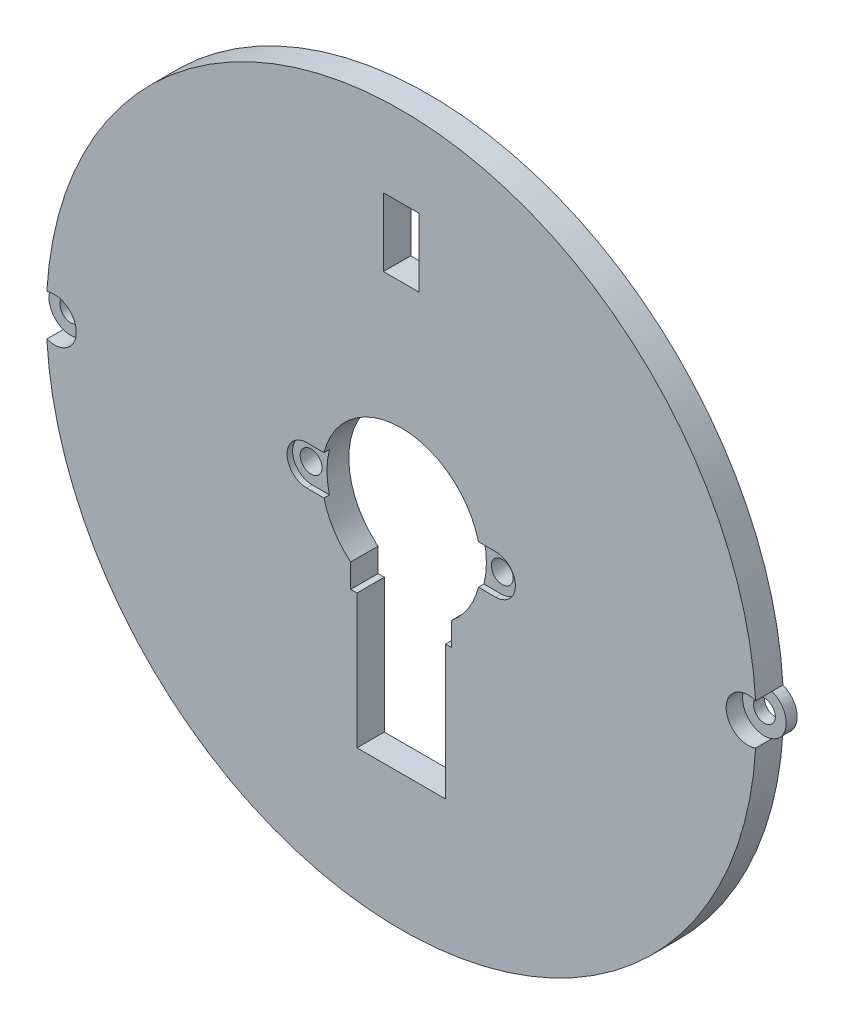
from build123d import *

# Parameters (mm, degrees)
SKETCH1_R           = 2
SKETCH1_W           = 6.5
SKETCH1_H           = 12.5
BOSS_EXTRUDE1_DEPTH = 5
SKETCH1_3_R         = 2
BOSS_EXTRUDE2_DEPTH = 4
SKETCH1_4_R         = 2
BOSS_EXTRUDE3_DEPTH = 1
SKETCH1_6_R         = 2
BOSS_EXTRUDE6_DEPTH = 5
SKETCH1_7_R         = 2
CUT_EXTRUDE1_DEPTH  = 3
SKETCH1_8_R         = 4
SKETCH1_8_R_2       = 2
BOSS_EXTRUDE7_DEPTH = 2


with BuildPart() as part:
    # Sketch1 → Boss-Extrude1 (new body)
    with BuildSketch(Plane.XY):
        with BuildLine():
            ThreePointArc((64.891732283, -3.750077499), (59.5, 0), (64.891732283, 3.750077499))
            ThreePointArc((64.891732283, 3.750077499), (0, 65), (-64.891732283, 3.750077499))
            ThreePointArc((-64.891732283, 3.750077499), (-61.216026394, 3.283818595), (-59.5, 0))
            ThreePointArc((-59.5, 0), (-61.216026394, -3.283818595), (-64.891732283, -3.750077499))
            ThreePointArc((-64.891732283, -3.750077499), (0, -65), (64.891732283, -3.750077499))
        make_face()
        with BuildLine():
            Line((-17.3, 3.6), (-14.149204925, 3.6))
            ThreePointArc((-14.149204925, 3.6), (0, 14.6), (14.149204925, 3.6))
            Line((14.149204925, 3.6), (17.3, 3.6))
            ThreePointArc((17.3, 3.6), (20.9, 0), (17.3, -3.6))
            Line((17.3, -3.6), (14.149204925, -3.6))
            ThreePointArc((14.149204925, -3.6), (12.316145556, -7.840443778), (9.25, -11.295906338))
            Line((9.25, -11.295906338), (9.25, -15.647016094))
            Line((9.25, -15.647016094), (8.1, -15.647016094))
            Line((8.1, -15.647016094), (8.1, -40.2))
            Line((8.1, -40.2), (-8.1, -40.2))
            Line((-8.1, -40.2), (-8.1, -15.647016094))
            Line((-8.1, -15.647016094), (-9.25, -15.647016094))
            Line((-9.25, -15.647016094), (-9.25, -11.295906338))
            ThreePointArc((-9.25, -11.295906338), (-12.316145556, -7.840443778), (-14.149204925, -3.6))
            Line((-14.149204925, -3.6), (-17.3, -3.6))
            ThreePointArc((-17.3, -3.6), (-20.9, 0), (-17.3, 3.6))
        make_face(mode=Mode.SUBTRACT)
        with Locations((0, 32)):
            Circle(SKETCH1_R, mode=Mode.SUBTRACT)
        with Locations((0, 44)):
            Rectangle(SKETCH1_W, SKETCH1_H, mode=Mode.SUBTRACT)
        with Locations((0, 56)):
            Circle(SKETCH1_R, mode=Mode.SUBTRACT)
    extrude(amount=BOSS_EXTRUDE1_DEPTH)

    # Sketch1<3> → Boss-Extrude2 (add)
    # profile 1 of 2: a face of its own
    with BuildSketch(Plane.XY):
        with BuildLine():
            ThreePointArc((-14.149204925, -3.6), (-14.6, 0), (-14.149204925, 3.6))
            Line((-14.149204925, 3.6), (-17.3, 3.6))
            ThreePointArc((-17.3, 3.6), (-20.9, 0), (-17.3, -3.6))
            Line((-17.3, -3.6), (-14.149204925, -3.6))
        make_face()
        with Locations((-17.5, 0)):
            Circle(SKETCH1_3_R, mode=Mode.SUBTRACT)
    # profile 2 of 2: a face of its own
    with BuildSketch(Plane.XY):
        with BuildLine():
            Line((17.3, 3.6), (14.149204925, 3.6))
            ThreePointArc((14.149204925, 3.6), (14.6, 0), (14.149204925, -3.6))
            Line((14.149204925, -3.6), (17.3, -3.6))
            ThreePointArc((17.3, -3.6), (20.9, 0), (17.3, 3.6))
        make_face()
        with Locations((17.5, 0)):
            Circle(SKETCH1_3_R, mode=Mode.SUBTRACT)
    extrude(amount=BOSS_EXTRUDE2_DEPTH)

    # Sketch1<4> → Boss-Extrude3 (add)
    with BuildSketch(Plane.XY):
        with Locations((17.5, 0)):
            Circle(SKETCH1_4_R)
        with Locations((-17.5, 0)):
            Circle(SKETCH1_4_R)
    extrude(amount=BOSS_EXTRUDE3_DEPTH)

    # Sketch1<6> → Boss-Extrude6 (add)
    with BuildSketch(Plane.XY):
        with Locations((0, 56)):
            Circle(SKETCH1_6_R)
        with Locations((0, 32)):
            Circle(SKETCH1_6_R)
    extrude(amount=BOSS_EXTRUDE6_DEPTH)

    # Sketch1<7> → Cut-Extrude1 (cut)
    with BuildSketch(Plane.XY):
        with Locations((0, 56)):
            Circle(SKETCH1_7_R)
        with Locations((0, 32)):
            Circle(SKETCH1_7_R)
    extrude(amount=CUT_EXTRUDE1_DEPTH, mode=Mode.SUBTRACT)

    # Sketch1<8> → Boss-Extrude7 (add)
    # profile 1 of 2: a face of its own
    with BuildSketch(Plane.XY):
        with Locations((63.5, 0)):
            Circle(SKETCH1_8_R)
        with Locations((63.5, 0)):
            Circle(SKETCH1_8_R_2, mode=Mode.SUBTRACT)
    # profile 2 of 2: a face of its own
    with BuildSketch(Plane.XY):
        with Locations((-63.5, 0)):
            Circle(SKETCH1_8_R)
        with Locations((-63.5, 0)):
            Circle(SKETCH1_8_R_2, mode=Mode.SUBTRACT)
    extrude(amount=BOSS_EXTRUDE7_DEPTH)


solid = part.part
